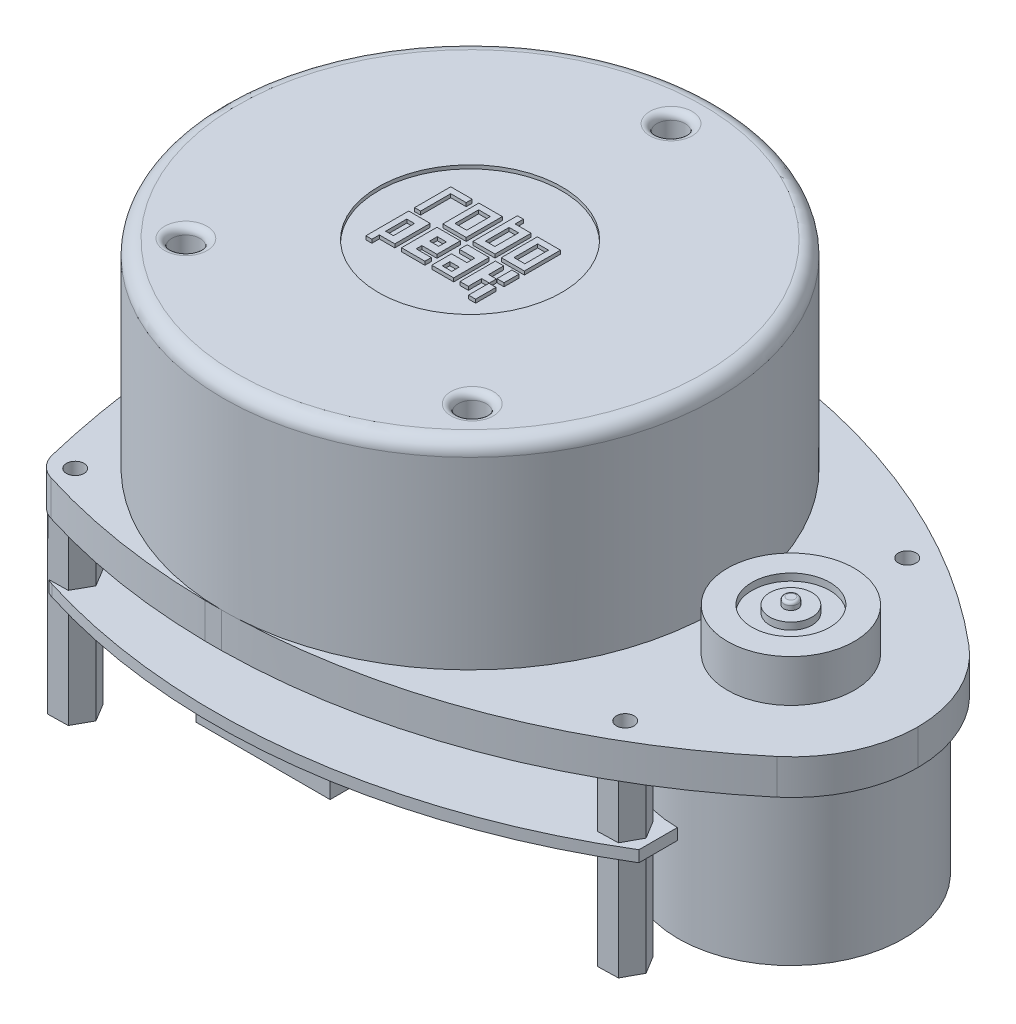
from build123d import *

# Parameters (mm, degrees)
SKETCH_1_W            = 98.5
SKETCH_1_H            = 70
EXTRUDE_1_DEPTH       = 5
SKETCH_2_R            = 35
EXTRUDE_2_DEPTH       = 28.1
SKETCH_3_R            = 2
CUT_EXTRUDE_1_DEPTH   = 5
FILLET_1_R            = 2
FILLET_2_R            = 1
SKETCH_4_R            = 13
SKETCH_4_W            = 3.316540618
SKETCH_4_H            = 5.120069114
SKETCH_4_W_2          = 3.276095001
SKETCH_4_W_3          = 1.001370982
SKETCH_4_H_2          = 2.121481923
SKETCH_4_H_3          = 2.893302243
SKETCH_4_W_4          = 1.096399653
SKETCH_4_H_4          = 2.99297568
SKETCH_4_W_5          = 1.536933457
SKETCH_4_H_5          = 3.356986235
SKETCH_4_W_6          = 1.658270309
SKETCH_4_W_7          = 1.334705371
SKETCH_4_H_6          = 1.05158605
SKETCH_4_W_8          = 1.294259754
SKETCH_4_H_7          = 1.092031667
CUT_EXTRUDE_3_DEPTH   = 0.5
SKETCH_5_R            = 1.25
CUT_EXTRUDE_4_DEPTH   = 5
SKETCH_6_R            = 9
EXTRUDE_3_DEPTH       = 7
CUT_EXTRUDE_START     = -1
SKETCH_7_R            = 9
SKETCH_7_R_2          = 0.99350654
CUT_EXTRUDE_5_DEPTH   = 1
SKETCH_8_R            = 5.521677929
SKETCH_8_R_2          = 3.001097475
CUT_EXTRUDE_6_DEPTH   = 1
FILLET_3_R            = 0.4
SKETCH_9_R            = 16
EXTRUDE_4_DEPTH       = 27
EXTRUDE_5_DEPTH       = 24.6
SKETCH_11_R           = 26
EXTRUDE_6_DEPTH       = 8
FILLET_4_R            = 1
SKETCH_12_W           = 106.251501727
SKETCH_12_H           = 75.565901032
CUT_EXTRUDE_7_DEPTH   = 8
FILLET_5_R            = 100
EXTRUDE_START         = 8
EXTRUDE_7_DEPTH       = 1.6
SKETCH_14_W           = 20
SKETCH_14_H           = 5
EXTRUDE_8_DEPTH       = 6
CHAMFER_1_SIZE        = 1
SKETCH_1_2_R          = 1.5
CUT_EXTRUDE_1_2_DEPTH = 10


with BuildPart() as part:
    # Sketch 1 → Бобышка-Вытянуть1 (new body)
    with BuildSketch(Plane(origin=(0, 0, 0), x_dir=(1, 0, 0), z_dir=(0, 1, 0))):
        Rectangle(SKETCH_1_W, SKETCH_1_H)
    extrude(amount=EXTRUDE_1_DEPTH)

    # Эскиз2 → Бобышка-Вытянуть2 (add)
    with BuildSketch(Plane(origin=(0, 5, 0), x_dir=(1, 0, 0), z_dir=(0, 1, 0))):
        with Locations(Location((-14.25, 0, 0), (0, 0, 270))):
            Circle(SKETCH_2_R)
    extrude(amount=EXTRUDE_2_DEPTH)

    # Эскиз3 → Cut-Extrude 1 (cut)
    with BuildSketch(Plane(origin=(0, 33.1, 0), x_dir=(1, 0, 0), z_dir=(0, 1, 0))):
        with Locations(Location((-14.25, 28.5, 0), (0, 0, 270))):
            Circle(SKETCH_3_R)
        with Locations(Location((-34.553940504, -20, 0), (0, 0, 270))):
            Circle(SKETCH_3_R)
        with Locations(Location((6.053940504, -20, 0), (0, 0, 270))):
            Circle(SKETCH_3_R)
    extrude(amount=-CUT_EXTRUDE_1_DEPTH, mode=Mode.SUBTRACT)

    # Скругление1
    fillet_1_edges = [part.edges().sort_by_distance(p)[0] for p in [
        (-14.25, 33.1, -35),
    ]]
    fillet(fillet_1_edges, radius=FILLET_1_R)

    # Скругление2
    fillet_2_edges = [part.edges().sort_by_distance(p)[0] for p in [
        (-14.25, 33.1, -30.5),
        (-34.553940504, 33.1, 18),
        (6.053940504, 33.1, 18),
    ]]
    fillet(fillet_2_edges, radius=FILLET_2_R)

    # Эскиз4 → Вырез-Вытянуть3 (cut)
    # profile 1 of 7: a face of its own
    with BuildSketch(Plane(origin=(0, 33.1, 0), x_dir=(1, 0, 0), z_dir=(0, 1, 0))):
        with Locations(Location((-14.25, 0, 0), (0, 0, 270))):
            Circle(SKETCH_4_R)
        Polygon((-22.115166942, -6.914876839), (-22.115166942, -0.831627154), (-19.0735421, -0.831627154), (-19.0735421, -5.853844917), (-21.266341405, -5.853844917), (-21.266341405, -6.914876839), align=None, mode=Mode.SUBTRACT)
        Polygon((-22.115166942, 0), (-22.115166942, 5.120069114), (-19.0735421, 5.120069114), (-19.0735421, 4.27071115), (-21.266341405, 4.27071115), (-21.266341405, 0), align=None, mode=Mode.SUBTRACT)
        Polygon((-13.829606569, 0), (-13.829606569, 6.292992015), (-12.980248606, 6.292992015), (-12.980248606, 5.120069114), (-10.715294037, 5.120069114), (-10.715294037, 0), align=None, mode=Mode.SUBTRACT)
        with Locations((-16.458571693, 2.560034557)):
            Rectangle(SKETCH_4_W, SKETCH_4_H, mode=Mode.SUBTRACT)
        with Locations((-8.187442955, 2.560034557)):
            Rectangle(SKETCH_4_W_2, SKETCH_4_H, mode=Mode.SUBTRACT)
        with Locations((-7.050080946, -1.825090787)):
            Rectangle(SKETCH_4_W_3, SKETCH_4_H_2, mode=Mode.SUBTRACT)
        with Locations((-7.050080946, -5.468225718)):
            Rectangle(SKETCH_4_W_3, SKETCH_4_H_3, mode=Mode.SUBTRACT)
        Polygon((-9.825490456, -0.831627154), (-8.643651064, -0.831627154), (-8.643651064, -2.960833634), (-7.550766437, -2.960833634), (-7.550766437, -3.957287265), (-8.643651064, -3.957287265), (-8.643651064, -5.853844917), (-9.825490456, -5.853844917), align=None, mode=Mode.SUBTRACT)
        Polygon((-13.829606569, -0.831627154), (-10.715294037, -0.831627154), (-10.715294037, -5.853844917), (-13.829606569, -5.853844917), (-13.829606569, -3.04994558), (-11.645543235, -3.04994558), (-11.645543235, -1.940786367), (-13.829606569, -1.940786367), align=None, mode=Mode.SUBTRACT)
        Polygon((-18.116842002, -0.831627154), (-14.800301384, -0.831627154), (-14.800301384, -4.141977247), (-16.943919101, -4.141977247), (-16.943919101, -4.950889593), (-14.800301384, -4.950889593), (-14.800301384, -5.853844917), (-18.116842002, -5.853844917), align=None, mode=Mode.SUBTRACT)
    # profile 2 of 7: a face of its own
    with BuildSketch(Plane(origin=(0, 33.1, 0), x_dir=(1, 0, 0), z_dir=(0, 1, 0))):
        with Locations((-20.718141579, -3.454401753)):
            Rectangle(SKETCH_4_W_4, SKETCH_4_H_4)
    # profile 3 of 7: a face of its own
    with BuildSketch(Plane(origin=(0, 33.1, 0), x_dir=(1, 0, 0), z_dir=(0, 1, 0))):
        with Locations((-8.167220148, 2.592218033)):
            Rectangle(SKETCH_4_W_5, SKETCH_4_H_5)
    # profile 4 of 7: a face of its own
    with BuildSketch(Plane(origin=(0, 33.1, 0), x_dir=(1, 0, 0), z_dir=(0, 1, 0))):
        with Locations((-16.478794502, 2.592218033)):
            Rectangle(SKETCH_4_W_6, SKETCH_4_H_5)
    # profile 5 of 7: a face of its own
    with BuildSketch(Plane(origin=(0, 33.1, 0), x_dir=(1, 0, 0), z_dir=(0, 1, 0))):
        with Locations((-12.312895921, 2.592218033)):
            Rectangle(SKETCH_4_W_7, SKETCH_4_H_5)
    # profile 6 of 7: a face of its own
    with BuildSketch(Plane(origin=(0, 33.1, 0), x_dir=(1, 0, 0), z_dir=(0, 1, 0))):
        with Locations((-12.312895921, -4.667770272)):
            Rectangle(SKETCH_4_W_7, SKETCH_4_H_6)
    # profile 7 of 7: a face of its own
    with BuildSketch(Plane(origin=(0, 33.1, 0), x_dir=(1, 0, 0), z_dir=(0, 1, 0))):
        with Locations((-16.296789224, -2.503929746)):
            Rectangle(SKETCH_4_W_8, SKETCH_4_H_7)
    extrude(amount=-CUT_EXTRUDE_3_DEPTH, mode=Mode.SUBTRACT)

    # Эскиз5 → Вырез-Вытянуть4 (cut)
    with BuildSketch(Plane(origin=(0, 5, 0), x_dir=(1, 0, 0), z_dir=(0, 1, 0))):
        with Locations(Location((-42.25, 28, 0), (0, 0, 270))):
            Circle(SKETCH_5_R)
        with Locations(Location((27.75, 20, 0), (0, 0, 270))):
            Circle(SKETCH_5_R)
        with Locations(Location((27.75, -20, 0), (0, 0, 90))):
            Circle(SKETCH_5_R)
        with Locations(Location((-42.25, -28, 0), (0, 0, 90))):
            Circle(SKETCH_5_R)
    extrude(amount=-CUT_EXTRUDE_4_DEPTH, mode=Mode.SUBTRACT)

    # Эскиз6 → Бобышка-Вытянуть3 (add)
    with BuildSketch(Plane(origin=(0, 5, 0), x_dir=(1, 0, 0), z_dir=(0, 1, 0))):
        with Locations(Location((31.25, 0, 0), (0, 0, 270))):
            Circle(SKETCH_6_R)
    extrude(amount=EXTRUDE_3_DEPTH)

    # Эскиз7 → Вырез-Вытянуть5 (cut)
    with BuildSketch(Plane(origin=(0, 12, 0), x_dir=(1, 0, 0), z_dir=(0, 1, 0)).offset(CUT_EXTRUDE_START)):
        with Locations(Location((31.25, 0, 0), (0, 0, 270))):
            Circle(SKETCH_7_R)
        with Locations(Location((31.25, 0, 0), (0, 0, 270))):
            Circle(SKETCH_7_R_2, mode=Mode.SUBTRACT)
    extrude(amount=CUT_EXTRUDE_5_DEPTH, mode=Mode.SUBTRACT)

    # Эскиз8 → Вырез-Вытянуть6 (cut)
    with BuildSketch(Plane(origin=(0, 11, 0), x_dir=(1, 0, 0), z_dir=(0, 1, 0))):
        with Locations(Location((31.25, 0, 0), (0, 0, 270))):
            Circle(SKETCH_8_R)
        with Locations(Location((31.25, 0, 0), (0, 0, 270))):
            Circle(SKETCH_8_R_2, mode=Mode.SUBTRACT)
    extrude(amount=-CUT_EXTRUDE_6_DEPTH, mode=Mode.SUBTRACT)

    # Скругление3
    fillet_3_edges = [part.edges().sort_by_distance(p)[0] for p in [
        (31.25, 12, -0.99350654),
    ]]
    fillet(fillet_3_edges, radius=FILLET_3_R)

    # Эскиз9 → Бобышка-Вытянуть4 (add)
    with BuildSketch(Plane(origin=(0, 5, 0), x_dir=(1, 0, 0), z_dir=(0, 1, 0))):
        with Locations(Location((31.25, 0, 0), (0, 0, 270))):
            Circle(SKETCH_9_R)
    extrude(amount=-EXTRUDE_4_DEPTH)

    # Эскиз10 → Бобышка-Вытянуть5 (add)
    with BuildSketch(Plane.XZ):
        Polygon((-40.854614908, 25.472900125), (-39.363774764, 27.944889), (-40.759159856, 30.471988875), (-43.645385092, 30.527099875), (-45.136225236, 28.055111), (-43.740840144, 25.528011125), align=None)
        Polygon((29.257133708, 22.462088812), (26.371335397, 22.536260484), (24.864201688, 20.074171672), (26.242866292, 17.537911188), (29.128664603, 17.463739516), (30.635798312, 19.925828328), align=None)
        Polygon((30.635798312, -19.925828328), (29.257133708, -22.462088812), (26.371335397, -22.536260484), (24.864201688, -20.074171672), (26.242866292, -17.537911188), (29.128664603, -17.463739516), align=None)
        Polygon((-43.740840144, -25.528011125), (-40.854614908, -25.472900125), (-39.363774764, -27.944889), (-40.759159856, -30.471988875), (-43.645385092, -30.527099875), (-45.136225236, -28.055111), align=None)
    extrude(amount=EXTRUDE_5_DEPTH)

    # Эскиз11 → Бобышка-Вытянуть6 (add)
    with BuildSketch(Plane(origin=(0, 5, 0), x_dir=(1, 0, 0), z_dir=(0, 1, 0))):
        with Locations(Location((-14.25, 0, 0), (0, 0, 270))):
            Circle(SKETCH_11_R)
    extrude(amount=-EXTRUDE_6_DEPTH)

    # Скругление4
    fillet_4_edges = [part.edges().sort_by_distance(p)[0] for p in [
        (-14.25, -3, -26),
    ]]
    fillet(fillet_4_edges, radius=FILLET_4_R)

    # Эскиз12 → Вырез-Вытянуть7 (cut)
    with BuildSketch(Plane(origin=(0, 5, 0), x_dir=(1, 0, 0), z_dir=(0, 1, 0))):
        with Locations((-0.925367694, -0.052186396)):
            Rectangle(SKETCH_12_W, SKETCH_12_H)
        with BuildLine():
            ThreePointArc((-49.25, 0), (-48.116981176, 14.083966884), (-45.528607092, 27.974329531))
            ThreePointArc((-45.528607092, 27.974329531), (-44.561596332, 29.769996926), (-42.834972324, 30.855492545))
            ThreePointArc((-42.834972324, 30.855492545), (2.249574036, 33.221442581), (42.908955543, 13.599293477))
            ThreePointArc((42.908955543, 13.599293477), (47.577997957, 7.498372972), (49.25, 0))
            ThreePointArc((49.25, 0), (47.577997957, -7.498372972), (42.908955543, -13.599293477))
            ThreePointArc((42.908955543, -13.599293477), (2.249574036, -33.221442581), (-42.834972324, -30.855492545))
            ThreePointArc((-42.834972324, -30.855492545), (-44.561596332, -29.769996926), (-45.528607092, -27.974329531))
            ThreePointArc((-45.528607092, -27.974329531), (-48.116981176, -14.083966884), (-49.25, 0))
        make_face(mode=Mode.SUBTRACT)
    extrude(amount=-CUT_EXTRUDE_7_DEPTH, mode=Mode.SUBTRACT)

    # Скругление5
    # the kernel refuses this fillet: 100 mm, written as the material it takes off along each edge
    with BuildSketch(Plane(origin=(-49.25, 5, 0), x_dir=(0.06766370453174418, 0, 0.9977081853372963), z_dir=(0, -1, 0))) as fillet_5_piece_1:
        with BuildLine():
            CenterArc((6.776645039, -99.922318338), FILLET_5_R, 87.741474483, 12.276669201)
            ThreePointArc((-10.619357471, -1.44704684), (-5.323940761, -0.618859533), (0, 0))
            ThreePointArc((0, 0), (5.358747467, 0.105631125), (10.717494933, 0))
        make_face()
    extrude(amount=31.793737334, mode=Mode.SUBTRACT)

    # Эскиз13 → Бобышка-Вытянуть7 (add)
    with BuildSketch(Plane.XZ.offset(EXTRUDE_START)):
        with BuildLine():
            Line((31.553634402, 21.860321538), (31.553634402, 16.4))
            ThreePointArc((31.553634402, 16.4), (15.153634402, 0), (31.553634402, -16.4))
            Line((31.553634402, -16.4), (31.553634402, -21.860321538))
            ThreePointArc((31.553634402, -21.860321538), (-4.596615235, -34.347840749), (-42.683124513, -30.855492545))
            ThreePointArc((-42.683124513, -30.855492545), (-44.409748521, -29.769996926), (-45.37675928, -27.974329531))
            ThreePointArc((-45.37675928, -27.974329531), (-47.965133365, -14.083966884), (-49.098152188, 0))
            ThreePointArc((-49.098152188, 0), (-47.965133365, 14.083966884), (-45.37675928, 27.974329531))
            ThreePointArc((-45.37675928, 27.974329531), (-44.409748521, 29.769996926), (-42.683124513, 30.855492545))
            ThreePointArc((-42.683124513, 30.855492545), (-4.596615235, 34.347840749), (31.553634402, 21.860321538))
        make_face()
    extrude(amount=EXTRUDE_7_DEPTH)

    # Эскиз14 → Бобышка-Вытянуть8 (add)
    with BuildSketch(Plane.XZ.offset(9.6)):
        with Locations((-14.098152188, 27.5)):
            Rectangle(SKETCH_14_W, SKETCH_14_H)
    extrude(amount=EXTRUDE_8_DEPTH)

    # Фаска1
    chamfer_1_edges = [part.edges().sort_by_distance(p)[0] for p in [
        (-24.098152188, -12.6, 30),
    ]]
    chamfer(chamfer_1_edges, length=CHAMFER_1_SIZE)

    # Sketch 1 2 → Cut-Extrude 1 2 (cut)
    with BuildSketch(Plane.XZ.offset(24.6)):
        with Locations(Location((27.75, 20, 0), (0, 0, 270))):
            Circle(SKETCH_1_2_R)
        with Locations(Location((27.75, -20, 0), (0, 0, 270))):
            Circle(SKETCH_1_2_R)
    extrude(amount=-CUT_EXTRUDE_1_2_DEPTH, mode=Mode.SUBTRACT)


solid = part.part
